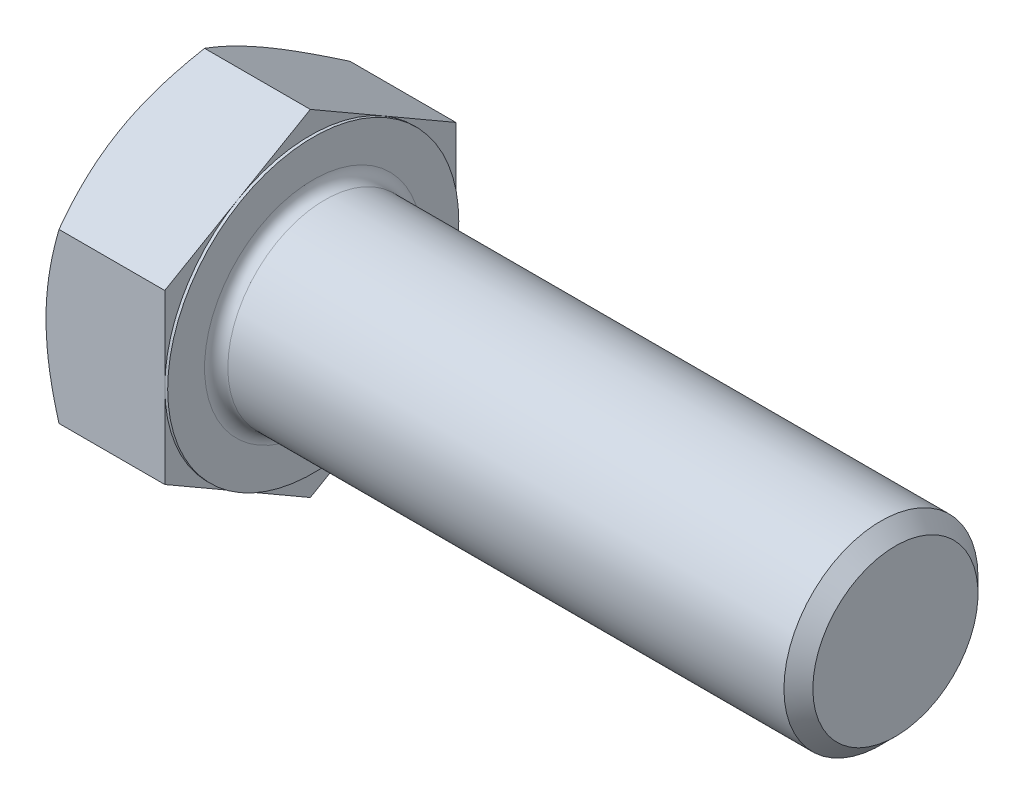
from build123d import *

# Parameters (mm, degrees)
BASEHEAD_DEPTH = 15.9258
SKETCH4_W      = 0.381
SKETCH4_H      = 28.347045256
HEADFILLET_R   = 1.524


with BuildPart() as part:
    # Sketch1 → BaseHead (new body)
    with BuildSketch(Plane(origin=(0, 0, 0), x_dir=(0, 0, -1), z_dir=(1, 0, 0))):
        Polygon((19.05, 10.998522628), (19.05, -10.998522628), (0, -21.997045256), (-19.05, -10.998522628), (-19.05, 10.998522628), (0, 21.997045256), align=None)
    extrude(amount=BASEHEAD_DEPTH)

    # BodySke → BaseBody (revolve)
    with BuildSketch(Plane.XY):
        Polygon((0, 0), (92.1258, 0), (92.1258, 10.8077), (90.2335, 12.7), (0, 12.7), align=None)
    revolve(axis=Axis((0, 0, 0), (1, 0, 0)))

    # Sketch3 → HeadChamfer (revolve, cut)
    with BuildSketch(Plane.XY):
        Polygon((0, 19.05), (5.367651581, 28.347045256), (5.367651581, 34.697045256), (-12.7, 34.697045256), (-12.7, 19.05), align=None)
    revolve(axis=Axis((0, 0, 0), (1, 0, 0)), mode=Mode.SUBTRACT)

    # Sketch4 → BearingFace (revolve, cut)
    with BuildSketch(Plane.XY):
        with Locations((15.7353, 33.223522628)):
            Rectangle(SKETCH4_W, SKETCH4_H)
    revolve(axis=Axis((0, 0, 0), (1, 0, 0)), mode=Mode.SUBTRACT)

    # HeadFillet
    headfillet_edges = [part.edges().sort_by_distance(p)[0] for p in [
        (15.9258, -12.7, 0),
    ]]
    fillet(headfillet_edges, radius=HEADFILLET_R)


solid = part.part
